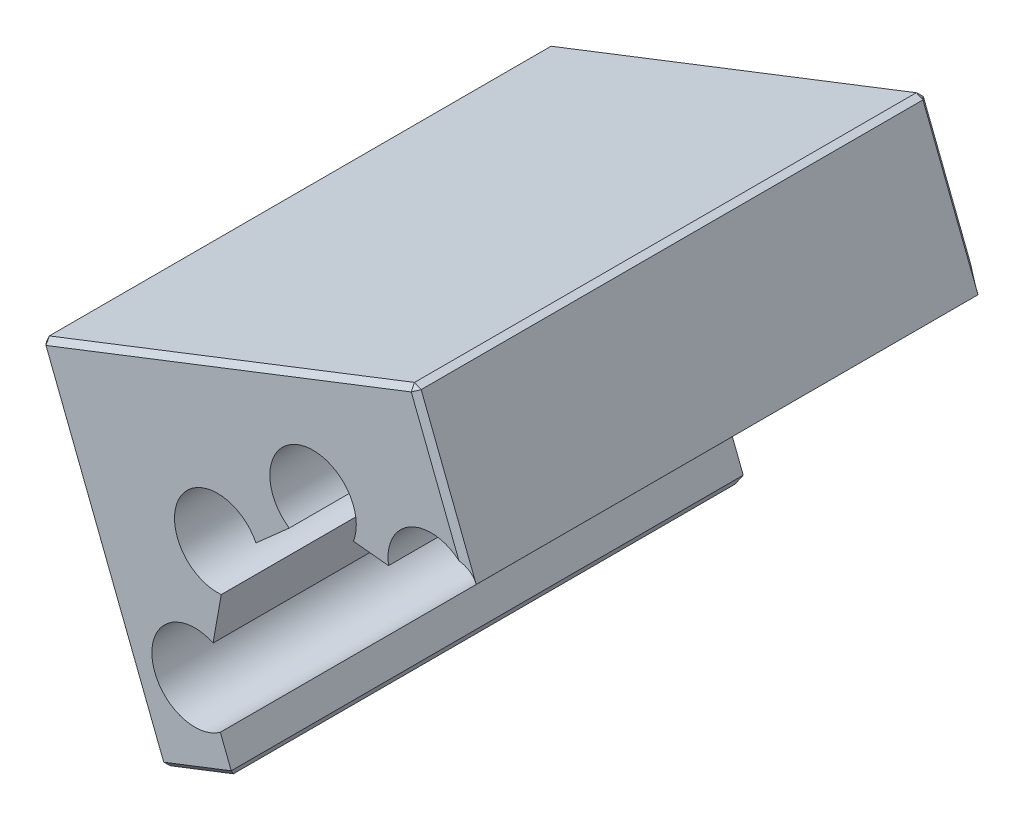
from build123d import *

# Parameters (mm, degrees)
EXTRUDE_2_DEPTH = 250
CHAMFER_1_SIZE  = 2.5


with BuildPart() as part:
    # 草圖1 → 填料-伸長2 (new body)
    with BuildSketch(Plane.XY.offset(-1.4731727719480525)):
        with BuildLine():
            Line((-112.11777063223668, -75.64023050952714), (-108.13973290199444, -53.16755899774324))
            ThreePointArc((-108.13973290199444, -53.16755899774324), (-128.28541716392445, -21.9976959729119), (-91.18146902098964, -22.837926640364703))
            Line((-91.18146902098964, -22.837926640364703), (-74.91518650356907, -8.426224479098595))
            ThreePointArc((-74.91518650356907, -8.426224479098595), (-69.76862631368554, 29.297285810426303), (-43.579874891032546, 1.6621703000019683))
            Line((-43.579874891032546, 1.6621703000019683), (-26.446012396901512, -0.08690302075969268))
            ThreePointArc((-26.446012396901512, -0.08690302075969268), (-11.20924853682007, 23.49241233452908), (13.857582965488481, 10.851326780396066))
            Line((13.857582965488481, 10.851326780396066), (-13.929514572378649, 82.14832405231925))
            Line((-13.929514572378649, 82.14832405231925), (-196.93306546339264, 10.825018542128108))
            Line((-196.93306546339264, 10.825018542128108), (-137.63840421554704, -141.31506357570169))
            Line((-137.63840421554704, -141.31506357570169), (-102.3514154071195, -127.56240866237148))
            Line((-102.3514154071195, -127.56240866237148), (-108.57535624014912, -111.59282810476189))
            ThreePointArc((-108.57535624014912, -111.59282810476189), (-141.90428180363014, -96.72591564369878), (-112.11777063223668, -75.64023050952714))
        make_face()
    extrude(amount=-EXTRUDE_2_DEPTH)

    # 導角1
    chamfer_1_edges = [part.edges().sort_by_distance(p)[0] for p in [
        (-105.43129001788564, 46.48667129722368, -251.47317277194804),
        (-0.03596580344508384, 46.49982541635766, -251.47317277194804),
        (-13.929514572378649, 82.14832405231925, -126.47317277194806),
        (-167.28573483946985, -65.24502251678679, -251.47317277194804),
        (-196.93306546339264, 10.825018542128108, -126.47317277194806),
        (-102.3514154071195, -127.56240866237148, -126.47317277194806),
        (-119.99490981133327, -134.43873611903658, -251.47317277194804),
        (-137.63840421554704, -141.31506357570169, -126.47317277194806),
        (-119.99490981133327, -134.43873611903658, -1.4731727719480525),
        (-167.28573483946985, -65.24502251678679, -1.4731727719480525),
        (-105.43129001788564, 46.48667129722368, -1.4731727719480525),
        (-0.03596580344508384, 46.49982541635766, -1.4731727719480525),
    ]]
    chamfer(chamfer_1_edges, length=CHAMFER_1_SIZE)


solid = part.part
